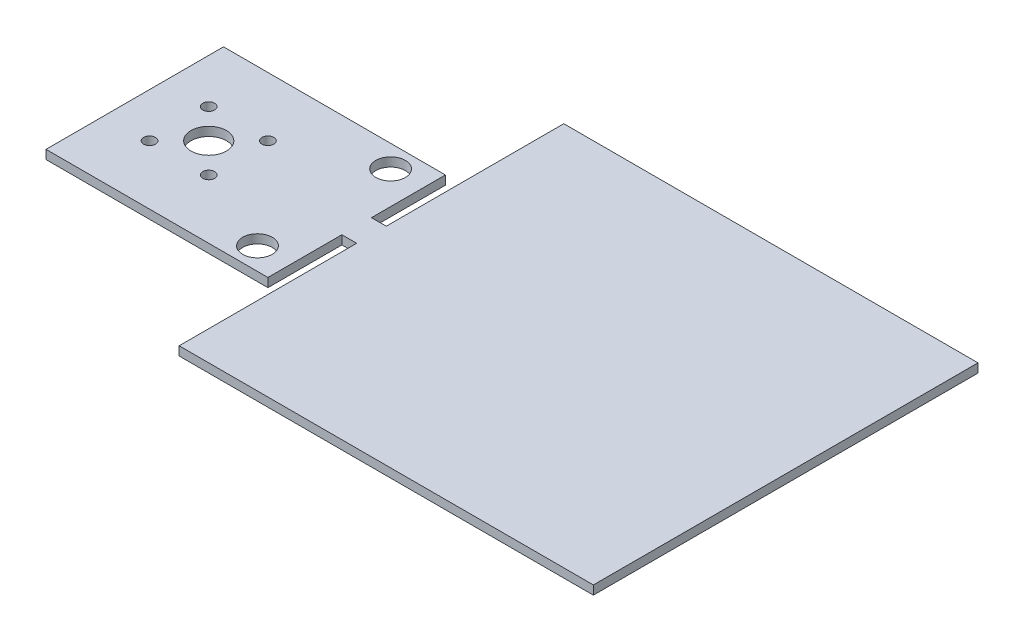
from build123d import *

# Parameters (mm, degrees)
SKETCH1_R             = 6
SKETCH1_R_2           = 2
SKETCH1_R_3           = 7.5
BOSS_EXTRUDE1_DEPTH   = 1.5
SKETCH2_W             = 115.219632385
SKETCH2_H             = 145.344306737
CUT_EXTRUDE1_DEPTH    = 164.505351594
DELETEFACE1_START     = -1.5
DELETEFACE1_OUTLINE_R = 7.5
DELETEFACE1_DEPTH     = 3
SKETCH4_R             = 5
CUT_EXTRUDE2_DEPTH    = 164.505351594


# Read off the part's stored shape, not the designer's step: DeleteFace1
with BuildPart() as part:
    # Sketch1 → Boss-Extrude1 (new, symmetric)
    with BuildSketch(Plane(origin=(0, 0, 0), x_dir=(1, 0, 0), z_dir=(0, 1, 0))):
        Polygon((70, 65), (70, 5), (75, 5), (75, 30), (150, 30), (150, -30), (75, -30), (75, -5), (70, -5), (70, -65), (-70, -65), (-70, -5), (-75, -5), (-75, -30), (-150, -30), (-150, 30), (-75, 30), (-75, 5), (-70, 5), (-70, 65), align=None)
        with Locations(Location((125, 0, 0), (0, 0, 270))):
            Circle(SKETCH1_R, mode=Mode.SUBTRACT)
        with Locations(Location((115, 10, 0), (0, 0, 270))):
            Circle(SKETCH1_R_2, mode=Mode.SUBTRACT)
        with Locations(Location((135, 10, 0), (0, 0, 90))):
            Circle(SKETCH1_R_2, mode=Mode.SUBTRACT)
        with Locations(Location((135, -10, 0), (0, 0, 270))):
            Circle(SKETCH1_R_2, mode=Mode.SUBTRACT)
        with Locations(Location((115, -10, 0), (0, 0, 90))):
            Circle(SKETCH1_R_2, mode=Mode.SUBTRACT)
        with Locations(Location((-115, -10, 0), (0, 0, 270))):
            Circle(SKETCH1_R_2, mode=Mode.SUBTRACT)
        with Locations(Location((-135, -10, 0), (0, 0, 90))):
            Circle(SKETCH1_R_2, mode=Mode.SUBTRACT)
        with Locations(Location((-135, 10, 0), (0, 0, 270))):
            Circle(SKETCH1_R_2, mode=Mode.SUBTRACT)
        with Locations(Location((-125, 0, 0), (0, 0, 90))):
            Circle(SKETCH1_R, mode=Mode.SUBTRACT)
        with Locations(Location((-115, 10, 0), (0, 0, 90))):
            Circle(SKETCH1_R_2, mode=Mode.SUBTRACT)
        with Locations(Location((100, 0, 0), (0, 0, 270))):
            Circle(SKETCH1_R_3, mode=Mode.SUBTRACT)
        with Locations(Location((-100, 0, 0), (0, 0, 90))):
            Circle(SKETCH1_R_3, mode=Mode.SUBTRACT)
    extrude(amount=BOSS_EXTRUDE1_DEPTH, both=True)

    # Sketch2 → Cut-Extrude1 (cut, through all)
    with BuildSketch(Plane(origin=(0, 1.5, 0), x_dir=(1, 0, 0), z_dir=(0, 1, 0))):
        with Locations((127.609816193, -7.672153369)):
            Rectangle(SKETCH2_W, SKETCH2_H)
    extrude(amount=-CUT_EXTRUDE1_DEPTH, mode=Mode.SUBTRACT)

    # DeleteFace1 outline → DeleteFace1 (add)
    with BuildSketch(Plane(origin=(0, 0, 0), x_dir=(1, 0, 0), z_dir=(0, 1, 0)).offset(DELETEFACE1_START)):
        with Locations((-100, 0)):
            Circle(DELETEFACE1_OUTLINE_R)
    extrude(amount=DELETEFACE1_DEPTH)

    # Sketch4 → Cut-Extrude2 (cut, through all)
    with BuildSketch(Plane(origin=(0, 1.5, 0), x_dir=(1, 0, 0), z_dir=(0, 1, 0))):
        with Locations(Location((-86.02885683, -22.5, 0), (0, 0, 270))):
            Circle(SKETCH4_R)
        with Locations(Location((-86.02885683, 22.5, 0), (0, 0, 90))):
            Circle(SKETCH4_R)
    extrude(amount=-CUT_EXTRUDE2_DEPTH, mode=Mode.SUBTRACT)


solid = part.part
